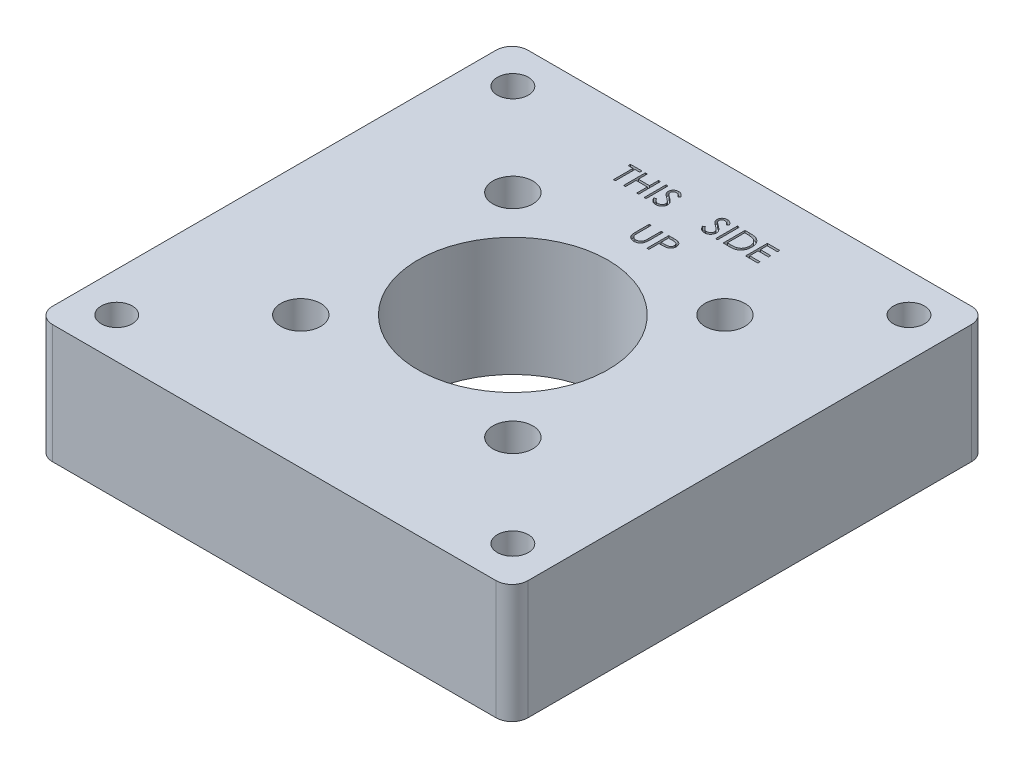
from build123d import *

# Parameters (mm, degrees)
SKETCH1_R                           = 15.24
BOSS_EXTRUDE2_DEPTH                 = 19.05
SKETCH3_R                           = 3.2
CUT_EXTRUDE2_DEPTH                  = 17.145
F_3_2_3_2_DIAMETER_HOLE2_AT_2_COUNT = 2
F_3_2_3_2_DIAMETER_HOLE2_AT_2_PITCH = 34
F_3_2_3_2_DIAMETER_HOLE2_AT_3_COUNT = 2
F_3_2_3_2_DIAMETER_HOLE2_AT_3_PITCH = 48.083261121
F_3_2_3_2_DIAMETER_HOLE2_AT_4_COUNT = 2
F_3_2_3_2_DIAMETER_HOLE2_AT_4_PITCH = 34
F_10_CLEARANCE_HOLE1_D              = 4.9784
SKETCH10_W                          = 0.314102565
SKETCH10_H                          = 3.5
SKETCH10_W_2                        = 0.314102564
CUT_EXTRUDE1_DEPTH                  = 0.635
FILLET2_R                           = 2.54


with BuildPart() as part:
    # Sketch1 → Boss-Extrude2 (new body)
    with BuildSketch(Plane(origin=(0, 0, 0), x_dir=(1, 0, 0), z_dir=(0, 1, 0))):
        Polygon((3.169508099, 88.395089045), (41.269508099, 88.395089045), (41.269508099, 12.195089045), (-34.930491901, 12.195089045), (-34.930491901, 88.395089045), align=None)
        with Locations((3.169508099, 50.431775554)):
            Circle(SKETCH1_R, mode=Mode.SUBTRACT)
    extrude(amount=BOSS_EXTRUDE2_DEPTH)

    # Sketch3 → Cut-Extrude2 (cut)
    with BuildSketch(Plane(origin=(0, 19.05, 0), x_dir=(1, 0, 0), z_dir=(0, 1, 0))):
        with Locations((20.169508099, 33.431775554)):
            Circle(SKETCH3_R)
        with Locations((-13.830491901, 33.431775554)):
            Circle(SKETCH3_R)
        with Locations((20.169508099, 67.431775554)):
            Circle(SKETCH3_R)
        with Locations((-13.830491901, 67.431775554)):
            Circle(SKETCH3_R)
    extrude(amount=-CUT_EXTRUDE2_DEPTH, mode=Mode.SUBTRACT)

    # Sketch5 → Ø3.2 (3.2) Diameter Hole2 (revolve, cut)
    with BuildSketch(Plane(origin=(-13.830491901, 1.905, -67.431775554), x_dir=(0, 0, 1), z_dir=(1, 0, 0))):
        Polygon((0, 0), (0, 1.905), (1.6, 1.905), (1.6, 1.4), (3, 0), align=None)
    f_3_2_3_2_diameter_hole2 = revolve(axis=Axis((-13.830491901, 8.255, -67.431775554), (0, -1, 0)), mode=Mode.SUBTRACT)

    # Ø3.2 (3.2) Diameter Hole2 at 2: Ø3.2 (3.2) Diameter Hole2 ×2
    with Locations(*[(i * F_3_2_3_2_DIAMETER_HOLE2_AT_2_PITCH, 0, 0) for i in range(1, F_3_2_3_2_DIAMETER_HOLE2_AT_2_COUNT)]):
        add(f_3_2_3_2_diameter_hole2, mode=Mode.SUBTRACT)

    # Ø3.2 (3.2) Diameter Hole2 at 3: Ø3.2 (3.2) Diameter Hole2 ×2
    with Locations(*[Vector(0.7071067811865477, 0, 0.7071067811865474) * (i * F_3_2_3_2_DIAMETER_HOLE2_AT_3_PITCH) for i in range(1, F_3_2_3_2_DIAMETER_HOLE2_AT_3_COUNT)]):
        add(f_3_2_3_2_diameter_hole2, mode=Mode.SUBTRACT)

    # Ø3.2 (3.2) Diameter Hole2 at 4: Ø3.2 (3.2) Diameter Hole2 ×2
    with Locations(*[(0, 0, i * F_3_2_3_2_DIAMETER_HOLE2_AT_4_PITCH) for i in range(1, F_3_2_3_2_DIAMETER_HOLE2_AT_4_COUNT)]):
        add(f_3_2_3_2_diameter_hole2, mode=Mode.SUBTRACT)

    # #10 Clearance Hole1 (through all)
    with Locations(Plane(origin=(0, 19.05, 0), x_dir=(1, 0, 0), z_dir=(0, 1, 0))):
        with Locations((34.919508099, 82.181775554), (-28.580491901, 82.181775554), (-28.580491901, 18.681775554), (34.919508099, 18.681775554)):
            Hole(F_10_CLEARANCE_HOLE1_D / 2)

    # Sketch10 → Cut-Extrude1 (cut)
    # profile 1 of 10: a face of its own
    with BuildSketch(Plane(origin=(0, 19.05, 0), x_dir=(1, 0, 0), z_dir=(0, 1, 0))):
        Polygon((-8.308104822, 80.409203908), (-8.308104822, 80.768178267), (-6.468361233, 80.768178267), (-6.468361233, 80.409203908), (-7.231181745, 80.409203908), (-7.231181745, 77.268178267), (-7.545284309, 77.268178267), (-7.545284309, 80.409203908), align=None)
    # profile 2 of 10: a face of its own
    with BuildSketch(Plane(origin=(0, 19.05, 0), x_dir=(1, 0, 0), z_dir=(0, 1, 0))):
        Polygon((-5.929899694, 80.768178267), (-5.61579713, 80.768178267), (-5.61579713, 79.332280831), (-3.820925335, 79.332280831), (-3.820925335, 80.768178267), (-3.506822771, 80.768178267), (-3.506822771, 77.268178267), (-3.820925335, 77.268178267), (-3.820925335, 78.973306472), (-5.61579713, 78.973306472), (-5.61579713, 77.268178267), (-5.929899694, 77.268178267), align=None)
    # profile 3 of 10: a face of its own
    with BuildSketch(Plane(origin=(0, 19.05, 0), x_dir=(1, 0, 0), z_dir=(0, 1, 0))):
        with Locations((-2.452335592, 79.018178267)):
            Rectangle(SKETCH10_W, SKETCH10_H)
    # profile 4 of 10: a face of its own
    with BuildSketch(Plane(origin=(0, 19.05, 0), x_dir=(1, 0, 0), z_dir=(0, 1, 0))):
        with BuildLine():
            Line((-1.756822771, 77.943358555), (-1.460949374, 78.120742369))
            add(Edge.make_bspline(
                [(-1.460949374, 78.120742369), (-1.433431136, 78.074677984), (-1.380707256, 77.9864204), (-1.292755897, 77.86716236), (-1.201622985, 77.765800203), (-1.106633652, 77.682923596), (-1.008367704, 77.617674709), (-0.90618365, 77.571472477), (-0.800425839, 77.542656502), (-0.728452018, 77.539156415), (-0.692519886, 77.537409036)],
                knots=[0, 0, 0, 0, 1.272034388, 2.437168799, 3.508375237, 4.49857839, 5.41946034, 6.295179144, 7.148887113, 8, 8, 8, 8], degree=3))
            add(Edge.make_bspline(
                [(-0.692519886, 77.537409036), (-0.661833026, 77.538263709), (-0.600996253, 77.539958099), (-0.51143401, 77.556238901), (-0.424452208, 77.58125103), (-0.34184357, 77.617071961), (-0.264747955, 77.660410447), (-0.19714126, 77.712756624), (-0.138695147, 77.77136283), (-0.090886032, 77.836745485), (-0.054205997, 77.907062633), (-0.026013929, 77.979238585), (-0.010368855, 78.054407153), (-0.008012101, 78.105017616), (-0.006822771, 78.130558074)],
                knots=[0, 0, 0, 0, 1.095163259, 2.171163733, 3.241058638, 4.321873601, 5.38011039, 6.391990106, 7.366004449, 8.327778327, 9.272591725, 10.192022065, 11.087607919, 12, 12, 12, 12], degree=3))
            add(Edge.make_bspline(
                [(-0.006822771, 78.130558074), (-0.008297082, 78.159698924), (-0.01129414, 78.218938013), (-0.03662562, 78.306337666), (-0.076474867, 78.392830236), (-0.113237511, 78.446331502), (-0.132323572, 78.474107754)],
                knots=[0, 0, 0, 0, 0.938893495, 1.908633276, 2.914225137, 4, 4, 4, 4], degree=3))
            add(Edge.make_bspline(
                [(-0.132323572, 78.474107754), (-0.147994186, 78.494154578), (-0.180892681, 78.536240376), (-0.237450193, 78.598885612), (-0.303816308, 78.663504031), (-0.377719863, 78.732563088), (-0.461852951, 78.802850884), (-0.553580466, 78.877719162), (-0.655244325, 78.954320739), (-0.726543821, 79.005693305), (-0.763333188, 79.032200703)],
                knots=[0, 0, 0, 0, 0.722233717, 1.516239348, 2.393582979, 3.351407094, 4.387010283, 5.505090956, 6.712668013, 8, 8, 8, 8], degree=3))
            add(Edge.make_bspline(
                [(-0.763333188, 79.032200703), (-0.800157184, 79.05842929), (-0.87056186, 79.108576353), (-0.969020443, 79.183000637), (-1.057064906, 79.251044506), (-1.134303922, 79.313348518), (-1.200703519, 79.369921123), (-1.25678693, 79.420219062), (-1.301125487, 79.465602623), (-1.325781068, 79.495043965), (-1.336850816, 79.508262401)],
                knots=[0, 0, 0, 0, 1.452282411, 2.77665338, 3.964542531, 5.026858415, 5.96415736, 6.766646006, 7.446254459, 8, 8, 8, 8], degree=3))
            add(Edge.make_bspline(
                [(-1.336850816, 79.508262401), (-1.352323361, 79.528863438), (-1.382752198, 79.569378142), (-1.422918203, 79.632703), (-1.457057366, 79.697526265), (-1.483819698, 79.76402213), (-1.506355917, 79.831257059), (-1.521513848, 79.900108304), (-1.531005245, 79.970266923), (-1.531977231, 80.017480423), (-1.532463797, 80.041114966)],
                knots=[0, 0, 0, 0, 1.068054152, 2.10047183, 3.106115577, 4.101338837, 5.06977816, 6.043150881, 7.020423561, 8, 8, 8, 8], degree=3))
            add(Edge.make_bspline(
                [(-1.532463797, 80.041114966), (-1.531158588, 80.07814474), (-1.528576068, 80.151412804), (-1.50673555, 80.258443634), (-1.472262657, 80.360630051), (-1.423967769, 80.456960385), (-1.361710416, 80.544926366), (-1.289664442, 80.625539853), (-1.203852955, 80.693308435), (-1.109700332, 80.752520494), (-1.00664396, 80.798866419), (-0.898653057, 80.833827399), (-0.785555985, 80.853636657), (-0.70895285, 80.856479422), (-0.670083989, 80.857921857)],
                knots=[0, 0, 0, 0, 1.005424448, 1.989358655, 2.955360095, 3.929531133, 4.905563448, 5.876582895, 6.856512386, 7.866279853, 8.892233794, 9.918561126, 10.94386622, 12, 12, 12, 12], degree=3))
            add(Edge.make_bspline(
                [(-0.670083989, 80.857921857), (-0.628839889, 80.856499305), (-0.546818537, 80.853670304), (-0.426169321, 80.829072773), (-0.310008605, 80.788372101), (-0.21656534, 80.742183443), (-0.143432579, 80.696052027), (-0.087659846, 80.654032203), (-0.031142395, 80.605657094), (0.02657566, 80.550797848), (0.084516319, 80.488951097), (0.143539771, 80.420540408), (0.20378404, 80.345983852), (0.2425399, 80.292759351), (0.262407998, 80.26547394)],
                knots=[0, 0, 0, 0, 1.286793592, 2.559021753, 3.825965368, 5.121522368, 5.803751409, 6.523245864, 7.299691795, 8.125521123, 9.008227632, 9.944561021, 10.946284179, 12, 12, 12, 12], degree=3))
            Line((0.262407998, 80.26547394), (-0.021546329, 80.050229549))
            add(Edge.make_bspline(
                [(-0.021546329, 80.050229549), (-0.038692261, 80.072318239), (-0.071711318, 80.114855892), (-0.121840805, 80.174427208), (-0.169089453, 80.228843688), (-0.215639853, 80.276108816), (-0.259033484, 80.318810949), (-0.301150527, 80.355370706), (-0.341384878, 80.386146301), (-0.392101788, 80.418989861), (-0.455819507, 80.451546365), (-0.535804043, 80.479095443), (-0.619390318, 80.495650505), (-0.67631995, 80.497839392), (-0.705140079, 80.498947498)],
                knots=[0, 0, 0, 0, 1.181633172, 2.275549214, 3.290209073, 4.226197932, 5.078386478, 5.862611352, 6.581680152, 7.217281963, 8.414376989, 9.595101626, 10.782541182, 12, 12, 12, 12], degree=3))
            add(Edge.make_bspline(
                [(-0.705140079, 80.498947498), (-0.741296601, 80.497735798), (-0.811021049, 80.495399148), (-0.910011285, 80.469879163), (-0.99910521, 80.429697303), (-1.075657775, 80.373382325), (-1.139394752, 80.306661332), (-1.185500211, 80.229882477), (-1.213250375, 80.145100074), (-1.216636655, 80.085958418), (-1.218361233, 80.055838523)],
                knots=[0, 0, 0, 0, 1.14458467, 2.207223713, 3.21896685, 4.227309161, 5.202851033, 6.127160689, 7.046193047, 8, 8, 8, 8], degree=3))
            add(Edge.make_bspline(
                [(-1.218361233, 80.055838523), (-1.217968106, 80.037087045), (-1.21718121, 79.999553425), (-1.206206412, 79.944102003), (-1.192107083, 79.888790664), (-1.169764451, 79.833868081), (-1.138919148, 79.778373722), (-1.098413972, 79.721351984), (-1.04740066, 79.662300276), (-1.008323648, 79.623892902), (-0.987692162, 79.603614966)],
                knots=[0, 0, 0, 0, 0.858281714, 1.717966888, 2.583508476, 3.4729293, 4.427298488, 5.488583878, 6.674047936, 8, 8, 8, 8], degree=3))
            add(Edge.make_bspline(
                [(-0.987692162, 79.603614966), (-0.98003079, 79.59677794), (-0.961829123, 79.580534731), (-0.928553197, 79.553942451), (-0.884610399, 79.521139678), (-0.831148197, 79.480552362), (-0.767180836, 79.4334709), (-0.692701279, 79.380497288), (-0.608539747, 79.319911829), (-0.548817831, 79.277554288), (-0.517239438, 79.255157433)],
                knots=[0, 0, 0, 0, 0.420754252, 0.999615792, 1.744751191, 2.668019286, 3.750313428, 4.999500688, 6.413464383, 8, 8, 8, 8], degree=3))
            add(Edge.make_bspline(
                [(-0.517239438, 79.255157433), (-0.479253524, 79.227516074), (-0.405699068, 79.173992412), (-0.301041488, 79.093576732), (-0.20614768, 79.014928964), (-0.120684476, 78.938551356), (-0.043807568, 78.865023263), (0.023630153, 78.793460083), (0.082315833, 78.72437451), (0.145495051, 78.635801935), (0.210052871, 78.52702085), (0.265494378, 78.393742612), (0.300452726, 78.259946291), (0.305024241, 78.170019455), (0.307279793, 78.125650222)],
                knots=[0, 0, 0, 0, 1.163667725, 2.253281268, 3.268753668, 4.215851969, 5.092017293, 5.902905408, 6.650798638, 7.335211899, 8.59617414, 9.77448103, 10.901945474, 12, 12, 12, 12], degree=3))
            add(Edge.make_bspline(
                [(0.307279793, 78.125650222), (0.306622655, 78.094271857), (0.30532114, 78.032124473), (0.290360226, 77.940869396), (0.268440561, 77.852238527), (0.235403327, 77.767327414), (0.195080169, 77.684582652), (0.143913921, 77.606174751), (0.084606236, 77.530368353), (0.016572471, 77.459184861), (-0.057873431, 77.393838665), (-0.136557126, 77.335709604), (-0.219607399, 77.28724128), (-0.306573715, 77.247690438), (-0.397476052, 77.216756921), (-0.492283836, 77.194344052), (-0.591153347, 77.180588341), (-0.658353829, 77.179160579), (-0.692519886, 77.178434677)],
                knots=[0, 0, 0, 0, 0.983748083, 1.948392443, 2.894712957, 3.844097841, 4.80183111, 5.778335162, 6.776009319, 7.81870978, 8.863265674, 9.881300176, 10.883814829, 11.87499822, 12.874611388, 13.892143829, 14.928324115, 16, 16, 16, 16], degree=3))
            add(Edge.make_bspline(
                [(-0.692519886, 77.178434677), (-0.718955229, 77.178945859), (-0.771492989, 77.179961784), (-0.849202471, 77.188943064), (-0.925342061, 77.201650168), (-0.998956343, 77.221824238), (-1.070993754, 77.246301215), (-1.141140989, 77.276439548), (-1.209432043, 77.312556749), (-1.276249625, 77.353851774), (-1.3414238, 77.401909518), (-1.404343268, 77.457883015), (-1.467072453, 77.52022852), (-1.52775985, 77.590639083), (-1.587632994, 77.667977166), (-1.645511404, 77.752966349), (-1.702593121, 77.845143703), (-1.738408589, 77.910008789), (-1.756822771, 77.943358555)],
                knots=[0, 0, 0, 0, 0.915332311, 1.819136955, 2.706846663, 3.586547465, 4.459518054, 5.340707479, 6.227863349, 7.133153174, 8.059268498, 9.028702269, 10.047606654, 11.120612155, 12.245963614, 13.433783089, 14.680604001, 16, 16, 16, 16], degree=3))
        make_face()
    # profile 5 of 10: a face of its own
    with BuildSketch(Plane(origin=(0, 19.05, 0), x_dir=(1, 0, 0), z_dir=(0, 1, 0))):
        with BuildLine():
            Line((6.050869537, 77.943358555), (6.346742934, 78.120742369))
            add(Edge.make_bspline(
                [(6.346742934, 78.120742369), (6.374261171, 78.074677984), (6.426985052, 77.9864204), (6.514936411, 77.86716236), (6.606069322, 77.765800203), (6.701058656, 77.682923596), (6.799324604, 77.617674709), (6.901508658, 77.571472477), (7.007266468, 77.542656502), (7.07924029, 77.539156415), (7.115172421, 77.537409036)],
                knots=[0, 0, 0, 0, 1.272034388, 2.437168799, 3.508375237, 4.49857839, 5.41946034, 6.295179144, 7.148887113, 8, 8, 8, 8], degree=3))
            add(Edge.make_bspline(
                [(7.115172421, 77.537409036), (7.145859282, 77.538263709), (7.206696055, 77.539958099), (7.296258298, 77.556238901), (7.3832401, 77.58125103), (7.465848738, 77.617071961), (7.542944352, 77.660410447), (7.610551048, 77.712756624), (7.668997161, 77.77136283), (7.716806275, 77.836745485), (7.753486311, 77.907062633), (7.781678379, 77.979238585), (7.797323453, 78.054407153), (7.799680206, 78.105017616), (7.800869537, 78.130558074)],
                knots=[0, 0, 0, 0, 1.095163259, 2.171163733, 3.241058638, 4.321873601, 5.38011039, 6.391990106, 7.366004449, 8.327778327, 9.272591725, 10.192022065, 11.087607919, 12, 12, 12, 12], degree=3))
            add(Edge.make_bspline(
                [(7.800869537, 78.130558074), (7.799395226, 78.159698924), (7.796398168, 78.218938013), (7.771066688, 78.306337666), (7.731217441, 78.392830236), (7.694454797, 78.446331502), (7.675368735, 78.474107754)],
                knots=[0, 0, 0, 0, 0.938893495, 1.908633276, 2.914225137, 4, 4, 4, 4], degree=3))
            add(Edge.make_bspline(
                [(7.675368735, 78.474107754), (7.659698121, 78.494154578), (7.626799627, 78.536240376), (7.570242114, 78.598885612), (7.503876, 78.663504031), (7.429972445, 78.732563088), (7.345839356, 78.802850884), (7.254111842, 78.877719162), (7.152447983, 78.954320739), (7.081148486, 79.005693305), (7.04435912, 79.032200703)],
                knots=[0, 0, 0, 0, 0.722233717, 1.516239348, 2.393582979, 3.351407094, 4.387010283, 5.505090956, 6.712668013, 8, 8, 8, 8], degree=3))
            add(Edge.make_bspline(
                [(7.04435912, 79.032200703), (7.007535124, 79.05842929), (6.937130447, 79.108576353), (6.838671865, 79.183000637), (6.750627402, 79.251044506), (6.673388385, 79.313348518), (6.606988789, 79.369921123), (6.550905377, 79.420219062), (6.50656682, 79.465602623), (6.48191124, 79.495043965), (6.470841492, 79.508262401)],
                knots=[0, 0, 0, 0, 1.452282411, 2.77665338, 3.964542531, 5.026858415, 5.96415736, 6.766646006, 7.446254459, 8, 8, 8, 8], degree=3))
            add(Edge.make_bspline(
                [(6.470841492, 79.508262401), (6.455368947, 79.528863438), (6.42494011, 79.569378142), (6.384774104, 79.632703), (6.350634942, 79.697526265), (6.323872609, 79.76402213), (6.301336391, 79.831257059), (6.28617846, 79.900108304), (6.276687063, 79.970266923), (6.275715076, 80.017480423), (6.275228511, 80.041114966)],
                knots=[0, 0, 0, 0, 1.068054152, 2.10047183, 3.106115577, 4.101338837, 5.06977816, 6.043150881, 7.020423561, 8, 8, 8, 8], degree=3))
            add(Edge.make_bspline(
                [(6.275228511, 80.041114966), (6.27653372, 80.07814474), (6.27911624, 80.151412804), (6.300956757, 80.258443634), (6.335429651, 80.360630051), (6.383724539, 80.456960385), (6.445981892, 80.544926366), (6.518027866, 80.625539853), (6.603839352, 80.693308435), (6.697991976, 80.752520494), (6.801048348, 80.798866419), (6.909039251, 80.833827399), (7.022136323, 80.853636657), (7.098739458, 80.856479422), (7.137608319, 80.857921857)],
                knots=[0, 0, 0, 0, 1.005424448, 1.989358655, 2.955360095, 3.929531133, 4.905563448, 5.876582895, 6.856512386, 7.866279853, 8.892233794, 9.918561126, 10.94386622, 12, 12, 12, 12], degree=3))
            add(Edge.make_bspline(
                [(7.137608319, 80.857921857), (7.178852419, 80.856499305), (7.260873771, 80.853670304), (7.381522986, 80.829072773), (7.497683703, 80.788372101), (7.591126968, 80.742183443), (7.664259729, 80.696052027), (7.720032462, 80.654032203), (7.776549912, 80.605657094), (7.834267967, 80.550797848), (7.892208627, 80.488951097), (7.951232079, 80.420540408), (8.011476348, 80.345983852), (8.050232208, 80.292759351), (8.070100306, 80.26547394)],
                knots=[0, 0, 0, 0, 1.286793592, 2.559021753, 3.825965368, 5.121522368, 5.803751409, 6.523245864, 7.299691795, 8.125521123, 9.008227632, 9.944561021, 10.946284179, 12, 12, 12, 12], degree=3))
            Line((8.070100306, 80.26547394), (7.786145979, 80.050229549))
            add(Edge.make_bspline(
                [(7.786145979, 80.050229549), (7.769000046, 80.072318239), (7.735980989, 80.114855892), (7.685851503, 80.174427208), (7.638602855, 80.228843688), (7.592052455, 80.276108816), (7.548658823, 80.318810949), (7.506541781, 80.355370706), (7.46630743, 80.386146301), (7.415590519, 80.418989861), (7.351872801, 80.451546365), (7.271888265, 80.479095443), (7.18830199, 80.495650505), (7.131372358, 80.497839392), (7.102552229, 80.498947498)],
                knots=[0, 0, 0, 0, 1.181633172, 2.275549214, 3.290209073, 4.226197932, 5.078386478, 5.862611352, 6.581680152, 7.217281963, 8.414376989, 9.595101626, 10.782541182, 12, 12, 12, 12], degree=3))
            add(Edge.make_bspline(
                [(7.102552229, 80.498947498), (7.066395707, 80.497735798), (6.996671259, 80.495399148), (6.897681023, 80.469879163), (6.808587098, 80.429697303), (6.732034533, 80.373382325), (6.668297556, 80.306661332), (6.622192097, 80.229882477), (6.594441933, 80.145100074), (6.591055653, 80.085958418), (6.589331075, 80.055838523)],
                knots=[0, 0, 0, 0, 1.14458467, 2.207223713, 3.21896685, 4.227309161, 5.202851033, 6.127160689, 7.046193047, 8, 8, 8, 8], degree=3))
            add(Edge.make_bspline(
                [(6.589331075, 80.055838523), (6.589724202, 80.037087045), (6.590511098, 79.999553425), (6.601485896, 79.944102003), (6.615585225, 79.888790664), (6.637927856, 79.833868081), (6.66877316, 79.778373722), (6.709278336, 79.721351984), (6.760291648, 79.662300276), (6.79936866, 79.623892902), (6.820000146, 79.603614966)],
                knots=[0, 0, 0, 0, 0.858281714, 1.717966888, 2.583508476, 3.4729293, 4.427298488, 5.488583878, 6.674047936, 8, 8, 8, 8], degree=3))
            add(Edge.make_bspline(
                [(6.820000146, 79.603614966), (6.827661518, 79.59677794), (6.845863185, 79.580534731), (6.879139111, 79.553942451), (6.923081909, 79.521139678), (6.97654411, 79.480552362), (7.040511472, 79.4334709), (7.114991028, 79.380497288), (7.199152561, 79.319911829), (7.258874477, 79.277554288), (7.29045287, 79.255157433)],
                knots=[0, 0, 0, 0, 0.420754252, 0.999615792, 1.744751191, 2.668019286, 3.750313428, 4.999500688, 6.413464383, 8, 8, 8, 8], degree=3))
            add(Edge.make_bspline(
                [(7.29045287, 79.255157433), (7.328438783, 79.227516074), (7.40199324, 79.173992412), (7.50665082, 79.093576732), (7.601544628, 79.014928964), (7.687007831, 78.938551356), (7.76388474, 78.865023263), (7.83132246, 78.793460083), (7.890008141, 78.72437451), (7.953187359, 78.635801935), (8.017745179, 78.52702085), (8.073186686, 78.393742612), (8.108145034, 78.259946291), (8.112716549, 78.170019455), (8.114972101, 78.125650222)],
                knots=[0, 0, 0, 0, 1.163667725, 2.253281268, 3.268753668, 4.215851969, 5.092017293, 5.902905408, 6.650798638, 7.335211899, 8.59617414, 9.77448103, 10.901945474, 12, 12, 12, 12], degree=3))
            add(Edge.make_bspline(
                [(8.114972101, 78.125650222), (8.114314963, 78.094271857), (8.113013448, 78.032124473), (8.098052534, 77.940869396), (8.076132869, 77.852238527), (8.043095635, 77.767327414), (8.002772476, 77.684582652), (7.951606229, 77.606174751), (7.892298544, 77.530368353), (7.824264779, 77.459184861), (7.749818877, 77.393838665), (7.671135182, 77.335709604), (7.588084909, 77.28724128), (7.501118592, 77.247690438), (7.410216256, 77.216756921), (7.315408472, 77.194344052), (7.216538961, 77.180588341), (7.149338479, 77.179160579), (7.115172421, 77.178434677)],
                knots=[0, 0, 0, 0, 0.983748083, 1.948392443, 2.894712957, 3.844097841, 4.80183111, 5.778335162, 6.776009319, 7.81870978, 8.863265674, 9.881300176, 10.883814829, 11.87499822, 12.874611388, 13.892143829, 14.928324115, 16, 16, 16, 16], degree=3))
            add(Edge.make_bspline(
                [(7.115172421, 77.178434677), (7.088737078, 77.178945859), (7.036199318, 77.179961784), (6.958489836, 77.188943064), (6.882350247, 77.201650168), (6.808735965, 77.221824238), (6.736698553, 77.246301215), (6.666551319, 77.276439548), (6.598260265, 77.312556749), (6.531442682, 77.353851774), (6.466268508, 77.401909518), (6.40334904, 77.457883015), (6.340619854, 77.52022852), (6.279932458, 77.590639083), (6.220059314, 77.667977166), (6.162180904, 77.752966349), (6.105099186, 77.845143703), (6.069283719, 77.910008789), (6.050869537, 77.943358555)],
                knots=[0, 0, 0, 0, 0.915332311, 1.819136955, 2.706846663, 3.586547465, 4.459518054, 5.340707479, 6.227863349, 7.133153174, 8.059268498, 9.028702269, 10.047606654, 11.120612155, 12.245963614, 13.433783089, 14.680604001, 16, 16, 16, 16], degree=3))
        make_face()
    # profile 6 of 10: a face of its own
    with BuildSketch(Plane(origin=(0, 19.05, 0), x_dir=(1, 0, 0), z_dir=(0, 1, 0))):
        with Locations((8.989972101, 79.018178267)):
            Rectangle(SKETCH10_W_2, SKETCH10_H)
    # profile 7 of 10: a face of its own
    with BuildSketch(Plane(origin=(0, 19.05, 0), x_dir=(1, 0, 0), z_dir=(0, 1, 0))):
        with BuildLine():
            Line((10.04445928, 77.268178267), (10.04445928, 80.768178267))
            Line((10.04445928, 80.768178267), (10.751190049, 80.768178267))
            add(Edge.make_bspline(
                [(10.751190049, 80.768178267), (10.812659038, 80.767735697), (10.931416803, 80.766880654), (11.10302925, 80.761459263), (11.261813013, 80.751868797), (11.407245872, 80.737899271), (11.539727084, 80.720746237), (11.658885692, 80.699245833), (11.765337835, 80.673857662), (11.830807276, 80.652212212), (11.861766973, 80.641976344)],
                knots=[0, 0, 0, 0, 1.314313732, 2.53924729, 3.670748893, 4.714932338, 5.66265055, 6.526160246, 7.303039223, 8, 8, 8, 8], degree=3))
            add(Edge.make_bspline(
                [(11.861766973, 80.641976344), (11.902261712, 80.626545638), (11.982332904, 80.596034144), (12.096340027, 80.538477843), (12.20366539, 80.473264741), (12.304884535, 80.400308878), (12.397685361, 80.31754453), (12.485693258, 80.228487444), (12.565307981, 80.129899104), (12.638216278, 80.023824116), (12.703951937, 79.911512064), (12.761091095, 79.793176955), (12.808545088, 79.669419747), (12.847938315, 79.540584599), (12.878984772, 79.406388221), (12.900166704, 79.266674355), (12.914137694, 79.121995166), (12.915541745, 79.023820702), (12.916254152, 78.974007594)],
                knots=[0, 0, 0, 0, 0.984719456, 1.947108742, 2.898477687, 3.838006223, 4.779231079, 5.722358779, 6.681677486, 7.655904652, 8.64651281, 9.637519902, 10.640069247, 11.656948941, 12.698408672, 13.768548281, 14.867775369, 16, 16, 16, 16], degree=3))
            add(Edge.make_bspline(
                [(12.916254152, 78.974007594), (12.915625185, 78.930746355), (12.914385738, 78.845495566), (12.903256423, 78.719854671), (12.887080103, 78.597941099), (12.862035905, 78.480335399), (12.831633391, 78.366007181), (12.79266924, 78.256174937), (12.748033744, 78.149831128), (12.695983865, 78.048413652), (12.63884248, 77.952330279), (12.577520737, 77.861754751), (12.512084042, 77.77797953), (12.441908409, 77.700750918), (12.367900692, 77.630185339), (12.289576362, 77.565693324), (12.206733311, 77.508536769), (12.119742588, 77.456469661), (12.026066459, 77.411049305), (11.923930593, 77.372619295), (11.812899415, 77.34077268), (11.693245458, 77.314201784), (11.56476198, 77.293124482), (11.427323014, 77.278998089), (11.281139725, 77.269445156), (11.180760459, 77.268608763), (11.129094697, 77.268178267)],
                knots=[0, 0, 0, 0, 1.105936401, 2.179363191, 3.223086493, 4.248585256, 5.251745608, 6.245858792, 7.225916811, 8.198733463, 9.158002045, 10.082870192, 10.993790845, 11.873723703, 12.748670949, 13.606408763, 14.465103618, 15.319838547, 16.196477973, 17.123216899, 18.106603292, 19.147568657, 20.255746949, 21.433717677, 22.679120308, 24, 24, 24, 24], degree=3))
            Line((11.129094697, 77.268178267), (10.04445928, 77.268178267))
        make_face()
        with BuildLine():
            Line((10.358561844, 77.627152626), (10.760304633, 77.627152626))
            add(Edge.make_bspline(
                [(10.760304633, 77.627152626), (10.818033004, 77.627400722), (10.929065802, 77.627877902), (11.088723799, 77.632065105), (11.234603196, 77.638907043), (11.366724705, 77.648482121), (11.485013729, 77.661150736), (11.589717479, 77.675275639), (11.680492738, 77.692873089), (11.735422175, 77.708824049), (11.760805434, 77.716195094)],
                knots=[0, 0, 0, 0, 1.375205317, 2.645023457, 3.804390687, 4.853969522, 5.800190428, 6.637939096, 7.370582563, 8, 8, 8, 8], degree=3))
            add(Edge.make_bspline(
                [(11.760805434, 77.716195094), (11.792753796, 77.727446652), (11.855887434, 77.749681025), (11.94676852, 77.790238686), (12.031525524, 77.838280756), (12.11163555, 77.89168303), (12.185962205, 77.952329032), (12.255386321, 78.018900021), (12.319768123, 78.091734796), (12.378442431, 78.170742958), (12.430950735, 78.255432753), (12.476421964, 78.344971587), (12.516273496, 78.438378397), (12.547552088, 78.537087556), (12.572067672, 78.640216614), (12.58943236, 78.747772827), (12.600247085, 78.859736109), (12.601508533, 78.935888234), (12.602151588, 78.974708716)],
                knots=[0, 0, 0, 0, 0.998632004, 1.973411704, 2.929992603, 3.868527914, 4.809262121, 5.754881198, 6.702106254, 7.672490631, 8.653608572, 9.636854334, 10.631411391, 11.644891563, 12.686317036, 13.754757253, 14.855430412, 16, 16, 16, 16], degree=3))
            add(Edge.make_bspline(
                [(12.602151588, 78.974708716), (12.601638301, 79.015642196), (12.600629943, 79.09605638), (12.587955633, 79.214047075), (12.569434077, 79.327527726), (12.542650391, 79.436505921), (12.508519512, 79.541194274), (12.46592487, 79.641013784), (12.417258251, 79.737018653), (12.359354914, 79.826993018), (12.295939321, 79.912086127), (12.225561442, 79.990041043), (12.149339403, 80.061035343), (12.068104554, 80.126174656), (11.979567454, 80.182838332), (11.885813764, 80.233525013), (11.785468092, 80.276540904), (11.715655397, 80.299419767), (11.680176428, 80.311046857)],
                knots=[0, 0, 0, 0, 1.122418816, 2.205001699, 3.251619955, 4.274784885, 5.280384055, 6.268708349, 7.249350384, 8.229342522, 9.199999885, 10.157847722, 11.105861043, 12.055065948, 13.010012805, 13.98527497, 14.976112212, 16, 16, 16, 16], degree=3))
            add(Edge.make_bspline(
                [(11.680176428, 80.311046857), (11.650825281, 80.319163284), (11.588416691, 80.336421037), (11.486577227, 80.355246409), (11.371962078, 80.371850909), (11.244062376, 80.385908948), (11.103023917, 80.395996269), (10.948738229, 80.403567584), (10.781138625, 80.408674216), (10.664956091, 80.409022923), (10.604655594, 80.409203908)],
                knots=[0, 0, 0, 0, 0.674548936, 1.434276114, 2.292660221, 3.240891867, 4.284742987, 5.42552168, 6.663806718, 8, 8, 8, 8], degree=3))
            Line((10.604655594, 80.409203908), (10.358561844, 80.409203908))
            Line((10.358561844, 80.409203908), (10.358561844, 77.627152626))
        make_face(mode=Mode.SUBTRACT)
    # profile 8 of 10: a face of its own
    with BuildSketch(Plane(origin=(0, 19.05, 0), x_dir=(1, 0, 0), z_dir=(0, 1, 0))):
        Polygon((13.63420287, 80.768178267), (15.608561844, 80.768178267), (15.608561844, 80.409203908), (13.948305434, 80.409203908), (13.948305434, 79.332280831), (15.608561844, 79.332280831), (15.608561844, 78.973306472), (13.948305434, 78.973306472), (13.948305434, 77.627152626), (15.608561844, 77.627152626), (15.608561844, 77.268178267), (13.63420287, 77.268178267), align=None)
    # profile 9 of 10: a face of its own
    with BuildSketch(Plane(origin=(0, 19.05, 0), x_dir=(1, 0, 0), z_dir=(0, 1, 0))):
        with BuildLine():
            Line((1.518818255, 73.934844933), (1.832920819, 73.934844933))
            Line((1.832920819, 73.934844933), (1.832920819, 71.837789645))
            add(Edge.make_bspline(
                [(1.832920819, 71.837789645), (1.832874075, 71.808108909), (1.83278537, 71.751784598), (1.833377884, 71.671616298), (1.835037252, 71.600343839), (1.836083412, 71.537692491), (1.838410745, 71.483949744), (1.840308792, 71.438824433), (1.842749349, 71.402530231), (1.845682466, 71.381349305), (1.846943255, 71.372244773)],
                knots=[0, 0, 0, 0, 1.528628734, 2.90083645, 4.128790002, 5.200304208, 6.127813768, 6.898992206, 7.526736466, 8, 8, 8, 8], degree=3))
            add(Edge.make_bspline(
                [(1.846943255, 71.372244773), (1.852120713, 71.33939801), (1.8621839, 71.275555281), (1.887830278, 71.184646999), (1.923647779, 71.102715541), (1.966090821, 71.027204249), (2.022023433, 70.960214889), (2.089026968, 70.898503237), (2.170204736, 70.844531432), (2.260465342, 70.79518062), (2.35775058, 70.755515538), (2.457161846, 70.725522173), (2.557204825, 70.707243274), (2.62418099, 70.705126735), (2.657440049, 70.704075703)],
                knots=[0, 0, 0, 0, 1.035780045, 2.013197591, 2.933192213, 3.817615948, 4.702609284, 5.640816605, 6.646850145, 7.73207398, 8.84249596, 9.914020372, 10.964143139, 12, 12, 12, 12], degree=3))
            add(Edge.make_bspline(
                [(2.657440049, 70.704075703), (2.68599379, 70.705149553), (2.742936352, 70.707291051), (2.827542782, 70.720552482), (2.909942891, 70.744453048), (2.990543571, 70.775292806), (3.066094555, 70.816040397), (3.136637997, 70.863111237), (3.199601932, 70.918322113), (3.25705993, 70.979422457), (3.307094865, 71.048362257), (3.350466007, 71.123640396), (3.385991937, 71.206389742), (3.403535461, 71.264544165), (3.412548223, 71.294420254)],
                knots=[0, 0, 0, 0, 0.994687771, 1.983630487, 2.973142513, 3.978332533, 4.983357753, 5.956394766, 6.925816176, 7.893390482, 8.871859704, 9.88551698, 10.913711441, 12, 12, 12, 12], degree=3))
            add(Edge.make_bspline(
                [(3.412548223, 71.294420254), (3.415548348, 71.306768828), (3.422233836, 71.334286428), (3.428480881, 71.380807719), (3.434987406, 71.435697083), (3.439501976, 71.499348896), (3.443903197, 71.571549868), (3.44653627, 71.652676126), (3.447753303, 71.742433087), (3.448115983, 71.805070248), (3.448305434, 71.837789645)],
                knots=[0, 0, 0, 0, 0.558680831, 1.244966039, 2.062412453, 2.990489873, 4.051219941, 5.244515665, 6.560634259, 8, 8, 8, 8], degree=3))
            Line((3.448305434, 71.837789645), (3.448305434, 73.934844933))
            Line((3.448305434, 73.934844933), (3.762407998, 73.934844933))
            Line((3.762407998, 73.934844933), (3.762407998, 71.820962722))
            add(Edge.make_bspline(
                [(3.762407998, 71.820962722), (3.762153878, 71.782864343), (3.761657946, 71.70851304), (3.75735737, 71.599561681), (3.75050037, 71.4962087), (3.740812282, 71.398440203), (3.727975279, 71.306606044), (3.713700058, 71.219901276), (3.695520525, 71.138948283), (3.674287124, 71.063115865), (3.650013576, 70.990930352), (3.618572428, 70.922421737), (3.583147928, 70.855507338), (3.541133275, 70.791199229), (3.493921892, 70.729212676), (3.440470212, 70.669923601), (3.382546051, 70.612384554), (3.319186491, 70.558071488), (3.251435966, 70.508262811), (3.179496008, 70.46446504), (3.103919238, 70.427441423), (3.024902112, 70.396965498), (2.942410909, 70.374050899), (2.85644355, 70.356975743), (2.766804356, 70.347273446), (2.7058397, 70.345831516), (2.674968094, 70.345101344)],
                knots=[0, 0, 0, 0, 1.316592851, 2.569410997, 3.76748051, 4.895814652, 5.963796859, 6.97159953, 7.931736103, 8.829262218, 9.692595152, 10.560224239, 11.431080259, 12.30701507, 13.211635791, 14.121146779, 15.063487852, 16.031507147, 17.00238618, 17.966455255, 18.938106653, 19.907068911, 20.888905087, 21.893141452, 22.933117798, 24, 24, 24, 24], degree=3))
            add(Edge.make_bspline(
                [(2.674968094, 70.345101344), (2.641298992, 70.345886109), (2.575240333, 70.347425816), (2.477902266, 70.356248566), (2.384588069, 70.37286696), (2.294312192, 70.394026904), (2.208303695, 70.423210641), (2.125410251, 70.457308766), (2.04705157, 70.499186026), (1.971956441, 70.545779419), (1.902131685, 70.598204057), (1.838034282, 70.655344231), (1.779558411, 70.716284609), (1.727689715, 70.781684975), (1.68156883, 70.851036682), (1.641838617, 70.924535921), (1.607725373, 71.002154237), (1.590118806, 71.056107438), (1.581218094, 71.083382594)],
                knots=[0, 0, 0, 0, 1.13879206, 2.234305948, 3.301075583, 4.341971843, 5.366689343, 6.369221514, 7.369726634, 8.367512178, 9.355451585, 10.318319045, 11.268648973, 12.207971039, 13.137398894, 14.081662264, 15.030215811, 16, 16, 16, 16], degree=3))
            add(Edge.make_bspline(
                [(1.581218094, 71.083382594), (1.576040936, 71.102015168), (1.564811565, 71.142429637), (1.552786267, 71.209316126), (1.542677186, 71.286331043), (1.533171627, 71.373479662), (1.527562669, 71.470829528), (1.522645231, 71.578338444), (1.518783612, 71.696136406), (1.518806384, 71.778190921), (1.518818255, 71.820962722)],
                knots=[0, 0, 0, 0, 0.625038921, 1.35572334, 2.194682327, 3.136881307, 4.189498639, 5.346923369, 6.617055217, 8, 8, 8, 8], degree=3))
            Line((1.518818255, 71.820962722), (1.518818255, 73.934844933))
        make_face()
    # profile 10 of 10: a face of its own
    with BuildSketch(Plane(origin=(0, 19.05, 0), x_dir=(1, 0, 0), z_dir=(0, 1, 0))):
        with BuildLine():
            Line((4.659843896, 73.934844933), (5.346242133, 73.934844933))
            add(Edge.make_bspline(
                [(5.346242133, 73.934844933), (5.393453039, 73.934793037), (5.483911232, 73.934693602), (5.613626287, 73.931678856), (5.731436019, 73.927652164), (5.8370864, 73.922070271), (5.930902498, 73.91547368), (6.012459798, 73.906221641), (6.082399354, 73.896561345), (6.124305803, 73.886739939), (6.143417614, 73.882260799)],
                knots=[0, 0, 0, 0, 1.415646017, 2.712440637, 3.8905458, 4.950247383, 5.884950622, 6.709939814, 7.411656543, 8, 8, 8, 8], degree=3))
            add(Edge.make_bspline(
                [(6.143417614, 73.882260799), (6.167611147, 73.875638849), (6.215428125, 73.862550987), (6.284329168, 73.836337264), (6.349883013, 73.805255099), (6.412314572, 73.769831159), (6.470856655, 73.728545595), (6.526382696, 73.683071977), (6.578402676, 73.632360408), (6.626624068, 73.576979668), (6.670908865, 73.517859459), (6.709038548, 73.454117229), (6.740965775, 73.386825925), (6.768349047, 73.316032354), (6.788057501, 73.241142031), (6.802904401, 73.162675318), (6.812328028, 73.080640628), (6.81323059, 73.024580761), (6.813690049, 72.99604285)],
                knots=[0, 0, 0, 0, 0.999701418, 1.975846123, 2.934577507, 3.890451536, 4.834027766, 5.787354733, 6.749476667, 7.726910423, 8.712836071, 9.690891519, 10.682875813, 11.679750201, 12.712814741, 13.765529915, 14.8625177, 16, 16, 16, 16], degree=3))
            add(Edge.make_bspline(
                [(6.813690049, 72.99604285), (6.813268625, 72.967265073), (6.812444079, 72.910959409), (6.802547793, 72.828586621), (6.789217602, 72.749868231), (6.76872055, 72.674978781), (6.741874876, 72.60436301), (6.710382824, 72.536941778), (6.672399293, 72.473862106), (6.628754464, 72.414894989), (6.580202869, 72.359985076), (6.526949931, 72.309530282), (6.469210638, 72.263825943), (6.40716849, 72.2227696), (6.340218642, 72.18731332), (6.269376488, 72.155556015), (6.194026272, 72.128884955), (6.141883758, 72.114854893), (6.115372742, 72.107721536)],
                knots=[0, 0, 0, 0, 1.121902311, 2.195077645, 3.232258892, 4.234102512, 5.217864754, 6.176164875, 7.132989551, 8.084763148, 9.034132444, 9.988522005, 10.94243251, 11.903244335, 12.886203696, 13.894208494, 14.929344452, 16, 16, 16, 16], degree=3))
            add(Edge.make_bspline(
                [(6.115372742, 72.107721536), (6.093445408, 72.103058555), (6.04539038, 72.092839361), (5.966247658, 72.081430904), (5.874102272, 72.071693303), (5.769079992, 72.064392166), (5.651275087, 72.058141797), (5.52062383, 72.053173703), (5.376869753, 72.050443849), (5.276598509, 72.050303057), (5.224246941, 72.050229549)],
                knots=[0, 0, 0, 0, 0.601384939, 1.31797006, 2.144135048, 3.087295005, 4.142315834, 5.309527816, 6.595305764, 8, 8, 8, 8], degree=3))
            Line((5.224246941, 72.050229549), (4.97394646, 72.050229549))
            Line((4.97394646, 72.050229549), (4.97394646, 70.434844933))
            Line((4.97394646, 70.434844933), (4.659843896, 70.434844933))
            Line((4.659843896, 70.434844933), (4.659843896, 73.934844933))
        make_face()
        with BuildLine():
            Line((4.97394646, 73.575870574), (4.97394646, 72.409203908))
            Line((4.97394646, 72.409203908), (5.586726908, 72.401491568))
            add(Edge.make_bspline(
                [(5.586726908, 72.401491568), (5.616646834, 72.401476104), (5.674406634, 72.401446252), (5.757842857, 72.405431476), (5.835252145, 72.410032008), (5.90639672, 72.416767932), (5.971308655, 72.426289189), (6.030096183, 72.435900927), (6.082303466, 72.44980629), (6.143402668, 72.468529359), (6.211486016, 72.500461975), (6.285553564, 72.546811865), (6.34832415, 72.605892573), (6.402642447, 72.672320404), (6.445748325, 72.746219534), (6.477304317, 72.82528847), (6.495845475, 72.90871632), (6.498331669, 72.965804459), (6.499587485, 72.994640607)],
                knots=[0, 0, 0, 0, 1.160613943, 2.240541288, 3.23993089, 4.169200891, 5.011653406, 5.7853311, 6.478053781, 7.106038997, 8.262395093, 9.384106736, 10.481365981, 11.59014053, 12.70357646, 13.786202915, 14.881775077, 16, 16, 16, 16], degree=3))
            add(Edge.make_bspline(
                [(6.499587485, 72.994640607), (6.498324839, 73.02277912), (6.495814854, 73.078715002), (6.477158991, 73.160693763), (6.445809677, 73.238929467), (6.402353082, 73.311902552), (6.349611952, 73.378091356), (6.288312609, 73.435588484), (6.218599348, 73.481810186), (6.153751117, 73.511643468), (6.096149931, 73.529858743), (6.046117971, 73.542603584), (5.989627297, 73.55277919), (5.926659517, 73.561018693), (5.857702683, 73.568072154), (5.782164368, 73.572858131), (5.700330725, 73.575659588), (5.643520154, 73.575798543), (5.614070658, 73.575870574)],
                knots=[0, 0, 0, 0, 1.120700087, 2.227813068, 3.331159281, 4.466773991, 5.599788987, 6.693661531, 7.80175334, 8.91857717, 9.525282508, 10.207424825, 10.974604443, 11.810962634, 12.737642355, 13.736264703, 14.826523623, 16, 16, 16, 16], degree=3))
            Line((5.614070658, 73.575870574), (4.97394646, 73.575870574))
        make_face(mode=Mode.SUBTRACT)
    extrude(amount=-CUT_EXTRUDE1_DEPTH, mode=Mode.SUBTRACT)

    # Fillet2
    fillet2_edges = [part.edges().sort_by_distance(p)[0] for p in [
        (-34.930491901, 9.525, -12.195089045),
        (41.269508099, 9.525, -12.195089045),
        (41.269508099, 9.525, -88.395089045),
        (-34.930491901, 9.525, -88.395089045),
    ]]
    fillet(fillet2_edges, radius=FILLET2_R)


solid = part.part
